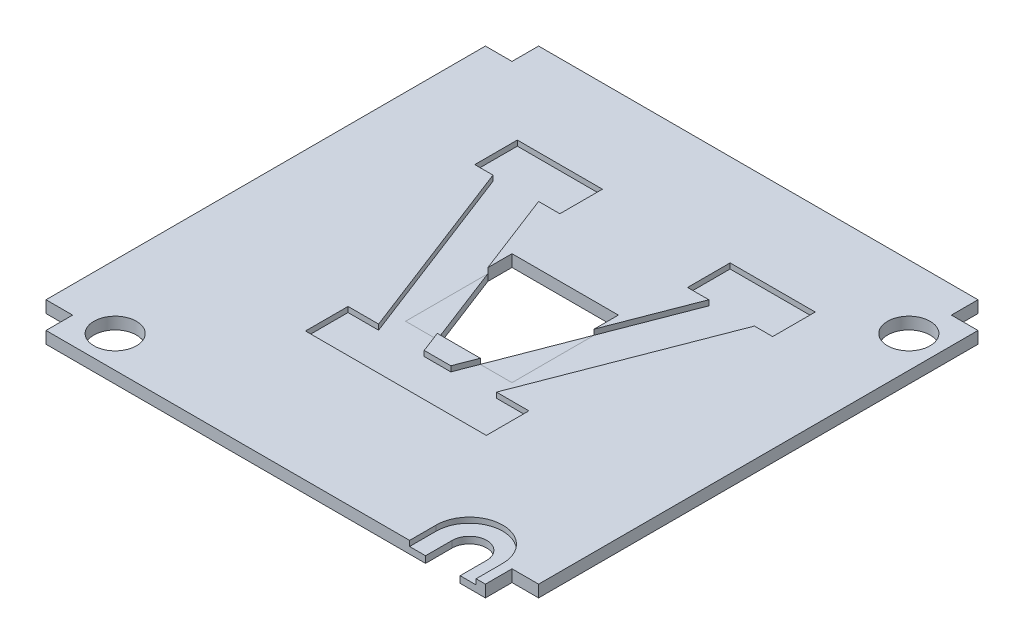
from build123d import *

# Parameters (mm, degrees)
BOSS_EXTRUDE1_DEPTH   = 2.25
SKETCH3_R             = 4
CUT_EXTRUDE1_DEPTH    = 10
CUT_EXTRUDE3_DEPTH    = 10
CUT_EXTRUDE4_DEPTH    = 1
SKETCH7_W             = 20
SKETCH7_H             = 20
CUT_EXTRUDE5_DEPTH    = 10
CUT_EXTRUDE7_DEPTH    = 1
BOSS_EXTRUDE3_DEPTH   = 2.25
BOSS_EXTRUDE3_2_DEPTH = 2.25
CUT_EXTRUDE8_DEPTH    = 1


with BuildPart() as part:
    # Sketch2 → Boss-Extrude1 (new body)
    with BuildSketch(Plane(origin=(0, 0, 0), x_dir=(1, 0, 0), z_dir=(0, 1, 0))):
        Polygon((-41.3, 41.3), (-46.3, 41.3), (-46.3, -41.3), (-41.3, -41.3), (-41.3, -46.3), (41.3, -46.3), (41.3, -41.3), (46.3, -41.3), (46.3, 41.3), (41.3, 41.3), (41.3, 46.3), (-41.3, 46.3), align=None)
    extrude(amount=BOSS_EXTRUDE1_DEPTH)

    # Sketch3 → Cut-Extrude1 (cut)
    with BuildSketch(Plane(origin=(0, 2.25, 0), x_dir=(1, 0, 0), z_dir=(0, 1, 0))):
        with Locations((-34.3, -40.3)):
            Circle(SKETCH3_R)
        with Locations((40.3, 34.3)):
            Circle(SKETCH3_R)
    extrude(amount=-CUT_EXTRUDE1_DEPTH, mode=Mode.SUBTRACT)

    # Sketch5 → Cut-Extrude3 (cut)
    with BuildSketch(Plane(origin=(0, 2.25, 0), x_dir=(1, 0, 0), z_dir=(0, 1, 0))):
        with BuildLine():
            Line((30.05, -41.3), (30.05, -46.3))
            Line((30.05, -46.3), (36.55, -46.3))
            Line((36.55, -46.3), (36.55, -41.3))
            ThreePointArc((36.55, -41.3), (33.3, -38.05), (30.05, -41.3))
        make_face()
    extrude(amount=-CUT_EXTRUDE3_DEPTH, mode=Mode.SUBTRACT)

    # Sketch6 → Cut-Extrude4 (cut)
    with BuildSketch(Plane(origin=(0, 2.25, 0), x_dir=(1, 0, 0), z_dir=(0, 1, 0))):
        with BuildLine():
            Line((27.05, -46.3), (27.05, -41.3))
            ThreePointArc((27.05, -41.3), (33.3, -35.05), (39.55, -41.3))
            Line((39.55, -41.3), (39.55, -46.3))
            Line((39.55, -46.3), (36.55, -46.3))
            Line((36.55, -46.3), (36.55, -41.3))
            Line((36.55, -41.3), (30.05, -41.3))
            Line((30.05, -41.3), (30.05, -46.3))
            Line((30.05, -46.3), (27.05, -46.3))
        make_face()
    extrude(amount=-CUT_EXTRUDE4_DEPTH, mode=Mode.SUBTRACT)

    # Sketch7 → Cut-Extrude5 (cut)
    with BuildSketch(Plane(origin=(0, 2.25, 0), x_dir=(1, 0, 0), z_dir=(0, 1, 0))):
        Rectangle(SKETCH7_W, SKETCH7_H)
    extrude(amount=-CUT_EXTRUDE5_DEPTH, mode=Mode.SUBTRACT)

    # Sketch18 → Cut-Extrude7 (cut)
    with BuildSketch(Plane(origin=(0, 2.25, 0), x_dir=(1, 0, 0), z_dir=(0, 1, 0))):
        Polygon((-2.5, -14), (-16, 21), (-12, 21), (-12, 29), (-28, 29), (-28, 21), (-24.574475649, 21), (-11.074475649, -14), (-16.824113427, -14), (-16.824113427, -22), (17.175886573, -22), (17.175886573, -14), (11.074475649, -14), (24.574475649, 21), (28, 21), (28, 29), (12, 29), (12, 21), (16, 21), (2.5, -14), align=None)
    extrude(amount=-CUT_EXTRUDE7_DEPTH, mode=Mode.SUBTRACT)


with BuildPart() as body_2:
    # Sketch19 → Boss-Extrude3 (new body)
    with BuildSketch(Plane(origin=(0, 2.25, 0), x_dir=(1, 0, 0), z_dir=(0, 1, 0))):
        Polygon((10, 5.444444444), (4.042857143, -10), (10, -10), align=None)
    extrude(amount=-BOSS_EXTRUDE3_DEPTH)


with BuildPart() as body_3:
    # Sketch19 → Boss-Extrude3 2 (new body)
    with BuildSketch(Plane(origin=(0, 2.25, 0), x_dir=(1, 0, 0), z_dir=(0, 1, 0))):
        Polygon((-4.042857143, -10), (-10, 5.444444444), (-10, -10), align=None)
    extrude(amount=-BOSS_EXTRUDE3_2_DEPTH)


with BuildPart() as cut_extrude8_tool:
    # Sketch20 → Cut-Extrude8 (new body)
    with BuildSketch(Plane(origin=(0, 2.25, 0), x_dir=(1, 0, 0), z_dir=(0, 1, 0))):
        Polygon((-10, 5.444444444), (-10, -10), (-4.042857143, -10), align=None)
        Polygon((4.042857143, -10), (10, 5.444444444), (10, -10), align=None)
    extrude(amount=-CUT_EXTRUDE8_DEPTH)


with BuildPart() as body_2_1:
    add(body_2.part)

    # Cut-Extrude8: cut by cut_extrude8_tool
    add(cut_extrude8_tool.part, mode=Mode.SUBTRACT)


with BuildPart() as body_3_1:
    add(body_3.part)

    # Cut-Extrude8: cut by cut_extrude8_tool
    add(cut_extrude8_tool.part, mode=Mode.SUBTRACT)


solid = Compound([part.part, body_2_1.part, body_3_1.part])
